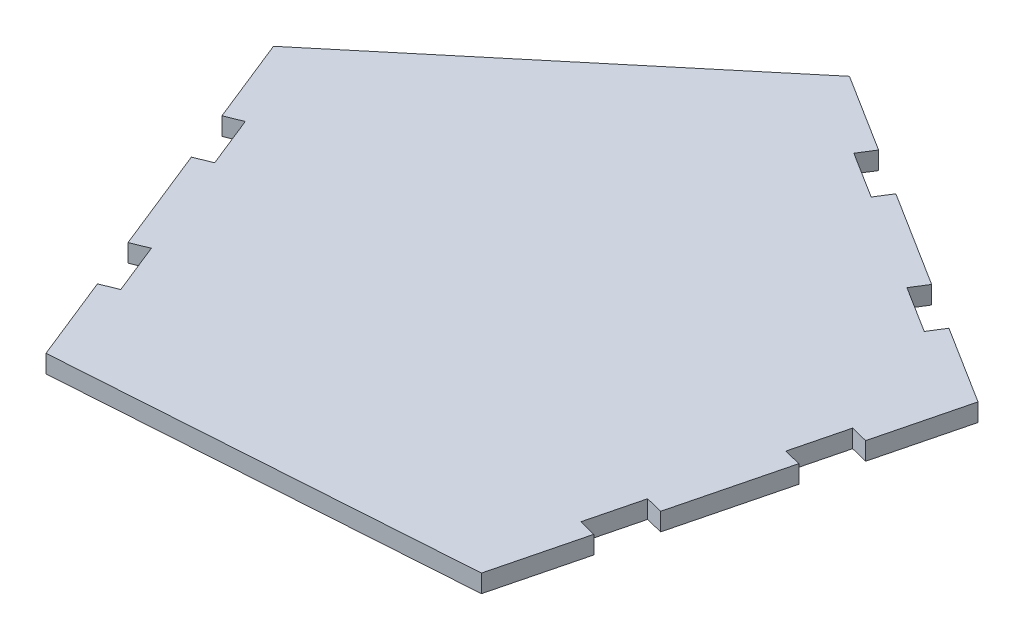
from build123d import *

# Parameters (mm, degrees)
BOSS_EXTRUDE1_DEPTH = 3.18
FEMALE_CUT_DEPTH    = 87.044973388
CIRPATTERN1_COUNT   = 5


with BuildPart() as part:
    # Sketch1 → Boss-Extrude1 (new body)
    with BuildSketch(Plane(origin=(0, 0, 0), x_dir=(1, 0, 0), z_dir=(0, 1, 0))):
        Polygon((-59.925822748, 15.118064705), (-32.896231583, -52.321105303), (39.594833528, -47.454286112), (57.367184482, 22.992743574), (-4.139963679, 61.664583135), align=None)
    extrude(amount=BOSS_EXTRUDE1_DEPTH)

    # Sketch2 → Female Cut (cut, through all)
    with BuildSketch(Plane.XZ):
        Polygon((-53.810711941, 0.139213692), (-50.858970613, -1.043842999), (-47.220513242, 8.034153915), (-50.17225457, 9.217210606), align=None)
        Polygon((-42.649799761, 27.985829992), (-39.011342391, 37.063826905), (-36.059601063, 35.880770214), (-39.698058434, 26.802773301), align=None)
    female_cut = extrude(amount=-FEMALE_CUT_DEPTH, mode=Mode.SUBTRACT)

    # CirPattern1: Female Cut ×5 about axis, 2 skipped
    cirpattern1_axis = Axis((0, 3.339, 0), (0, -1, 0))
    add([female_cut.rotate(cirpattern1_axis, i * 360 / CIRPATTERN1_COUNT) for i in range(1, CIRPATTERN1_COUNT) if i not in (1, 4)], mode=Mode.SUBTRACT)


solid = part.part
